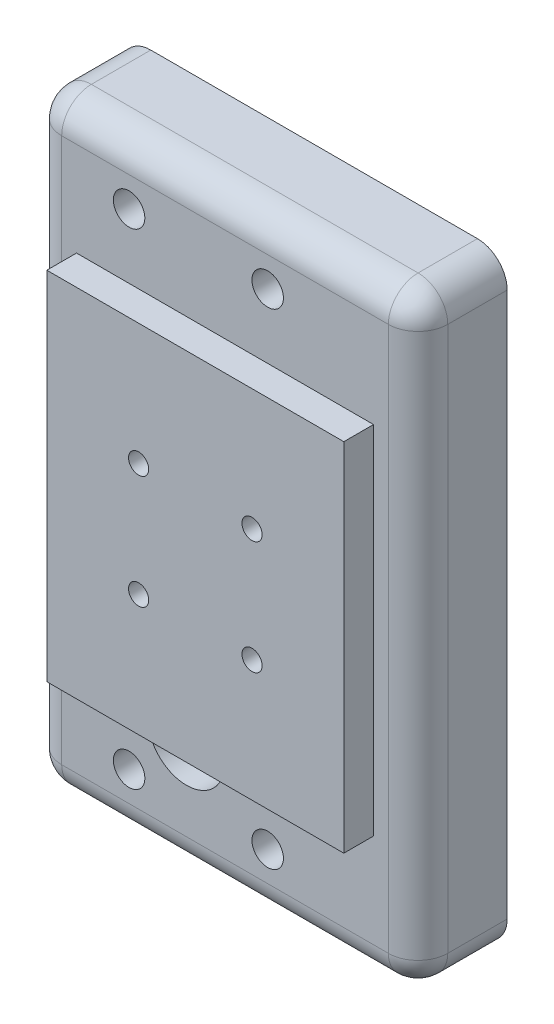
from build123d import *
from build123d.topology import SkipClean

# Parameters (mm, degrees)
STOCK_PART13_1_START       = -68.526253649
STOCK_PART13_1_OUTLINE_W   = 55
STOCK_PART13_1_OUTLINE_H   = 101.7
STOCK_PART13_1_OUTLINE_R   = 1.65
STOCK_PART13_1_OUTLINE_R_2 = 2.25
STOCK_PART13_1_OUTLINE_R_3 = 23.6
STOCK_PART13_1_DEPTH       = 7
SKETCH3_W                  = 5
SKETCH3_H                  = 101.7
BOSS_EXTRUDE1_DEPTH        = 7
FILLET2_R                  = 5
EXTRUDE_THIN1_START        = 8
EXTRUDE_THIN1_DEPTH        = 8
FILLET3_R                  = 5
BOSS_EXTRUDE2_START        = 3
SKETCH7_R                  = 1.65
SKETCH7_R_2                = 2.25
SKETCH7_R_3                = 23.6
BOSS_EXTRUDE2_DEPTH        = 3
SKETCH8_R                  = 23.6
SKETCH8_R_2                = 21
BOSS_EXTRUDE3_DEPTH        = 3
BOSS_EXTRUDE4_START        = -15
SKETCH9_R                  = 4
SKETCH9_R_2                = 1.65
BOSS_EXTRUDE4_DEPTH        = 15
SKETCH10_R                 = 6.5
CUT_EXTRUDE1_DEPTH         = 62.171664192
SKETCH11_W                 = 4
SKETCH11_H                 = 13
CUT_EXTRUDE4_DEPTH         = 62.171664192
FILLET4_R                  = 5
SKETCH12_R                 = 2.65
CUT_EXTRUDE5_DEPTH         = 63.18498613
SKETCH14_W                 = 50
SKETCH14_H                 = 60
SKETCH14_R                 = 1.7
BOSS_EXTRUDE5_DEPTH        = 5
SKETCH16_R                 = 1.95
BOSS_EXTRUDE6_DEPTH        = 10


# Read off the part's stored shape, not the designer's step: Stock-Part13-1
with BuildPart() as part:
    # Stock-Part13-1 outline → Stock-Part13-1 (new body)
    with BuildSketch(Plane.XY.offset(STOCK_PART13_1_START)):
        Rectangle(STOCK_PART13_1_OUTLINE_W, STOCK_PART13_1_OUTLINE_H)
        with Locations((-16.15, -40.85)):
            Circle(STOCK_PART13_1_OUTLINE_R, mode=Mode.SUBTRACT)
        with Locations((-21.15, -25)):
            Circle(STOCK_PART13_1_OUTLINE_R_2, mode=Mode.SUBTRACT)
        with Locations((7.183333333, -40.85)):
            Circle(STOCK_PART13_1_OUTLINE_R, mode=Mode.SUBTRACT)
        with Locations((18.85, -25)):
            Circle(STOCK_PART13_1_OUTLINE_R_2, mode=Mode.SUBTRACT)
        with Locations((-21.15, 25)):
            Circle(STOCK_PART13_1_OUTLINE_R_2, mode=Mode.SUBTRACT)
        with Locations((-16.15, 40.85)):
            Circle(STOCK_PART13_1_OUTLINE_R, mode=Mode.SUBTRACT)
        Circle(STOCK_PART13_1_OUTLINE_R_3, mode=Mode.SUBTRACT)
        with Locations((18.85, 25)):
            Circle(STOCK_PART13_1_OUTLINE_R_2, mode=Mode.SUBTRACT)
        with Locations((7.183333333, 40.85)):
            Circle(STOCK_PART13_1_OUTLINE_R, mode=Mode.SUBTRACT)
    extrude(amount=STOCK_PART13_1_DEPTH)

    # Sketch3 → Boss-Extrude1 (add)
    with BuildSketch(Plane.XY.offset(-61.526253649)):
        with Locations((-30, 0)):
            Rectangle(SKETCH3_W, SKETCH3_H)
        with Locations((30, 0)):
            Rectangle(SKETCH3_W, SKETCH3_H)
    extrude(amount=-BOSS_EXTRUDE1_DEPTH)

    # Fillet2
    fillet2_edges = [part.edges().sort_by_distance(p)[0] for p in [
        (-32.5, -50.85, -65.026253649),
        (-32.5, 50.85, -65.026253649),
        (32.5, 50.85, -65.026253649),
        (32.5, -50.85, -65.026253649),
    ]]
    fillet(fillet2_edges, radius=FILLET2_R)

    # Sketch5 → Extrude-Thin1 (add)
    with BuildSketch(Plane(origin=(0, 0, -68.526253649), x_dir=(-1, 0, 0), z_dir=(0, 0, -1)).offset(EXTRUDE_THIN1_START)):
        with BuildLine():
            Line((-27.5, -50.85), (27.5, -50.85))
            ThreePointArc((27.5, -50.85), (31.035533906, -49.385533906), (32.5, -45.85))
            Line((32.5, -45.85), (32.5, 45.85))
            ThreePointArc((32.5, 45.85), (31.035533906, 49.385533906), (27.5, 50.85))
            Line((27.5, 50.85), (-27.5, 50.85))
            ThreePointArc((-27.5, 50.85), (-31.035533906, 49.385533906), (-32.5, 45.85))
            Line((-32.5, 45.85), (-32.5, -45.85))
            ThreePointArc((-32.5, -45.85), (-31.035533906, -49.385533906), (-27.5, -50.85))
        make_face()
        with BuildLine():
            Line((-27.5, -46.85), (27.5, -46.85))
            ThreePointArc((27.5, -46.85), (28.207106781, -46.557106781), (28.5, -45.85))
            Line((28.5, -45.85), (28.5, 45.85))
            ThreePointArc((28.5, 45.85), (28.207106781, 46.557106781), (27.5, 46.85))
            Line((27.5, 46.85), (-27.5, 46.85))
            ThreePointArc((-27.5, 46.85), (-28.207106781, 46.557106781), (-28.5, 45.85))
            Line((-28.5, 45.85), (-28.5, -45.85))
            ThreePointArc((-28.5, -45.85), (-28.207106781, -46.557106781), (-27.5, -46.85))
        make_face(mode=Mode.SUBTRACT)
    extrude(amount=-EXTRUDE_THIN1_DEPTH)

    # Fillet3
    fillet3_edges = [part.edges().sort_by_distance(p)[0] for p in [
        (-32.5, 0, -61.526253649),
        (0, -50.85, -61.526253649),
        (32.5, 0, -61.526253649),
        (0, 50.85, -61.526253649),
        (-31.035533906, 49.385533906, -61.526253649),
        (31.035533906, 49.385533906, -61.526253649),
        (31.035533906, -49.385533906, -61.526253649),
        (-31.035533906, -49.385533906, -61.526253649),
    ]]
    fillet(fillet3_edges, radius=FILLET3_R)

    # Sketch7 → Boss-Extrude2 (add)
    with SkipClean():  # the faces are left unmerged after this step: merging them gives an invalid solid
        with BuildSketch(Plane(origin=(0, 0, -68.526253649), x_dir=(-1, 0, 0), z_dir=(0, 0, -1)).offset(BOSS_EXTRUDE2_START)):
            with BuildLine():
                Line((-28.5, 45.85), (-28.5, -45.85))
                ThreePointArc((-28.5, -45.85), (-28.207106781, -46.557106781), (-27.5, -46.85))
                Line((-27.5, -46.85), (27.5, -46.85))
                ThreePointArc((27.5, -46.85), (28.207106781, -46.557106781), (28.5, -45.85))
                Line((28.5, -45.85), (28.5, 45.85))
                ThreePointArc((28.5, 45.85), (28.207106781, 46.557106781), (27.5, 46.85))
                Line((27.5, 46.85), (-27.5, 46.85))
                ThreePointArc((-27.5, 46.85), (-28.207106781, 46.557106781), (-28.5, 45.85))
            make_face()
            with Locations((-7.183333333, -40.85)):
                Circle(SKETCH7_R, mode=Mode.SUBTRACT)
            with Locations((16.15, -40.85)):
                Circle(SKETCH7_R, mode=Mode.SUBTRACT)
            with Locations((21.15, -25)):
                Circle(SKETCH7_R_2, mode=Mode.SUBTRACT)
            with Locations((-18.85, -25)):
                Circle(SKETCH7_R_2, mode=Mode.SUBTRACT)
            Circle(SKETCH7_R_3, mode=Mode.SUBTRACT)
            with Locations((21.15, 25)):
                Circle(SKETCH7_R_2, mode=Mode.SUBTRACT)
            with Locations((-7.183333333, 40.85)):
                Circle(SKETCH7_R, mode=Mode.SUBTRACT)
            with Locations((16.15, 40.85)):
                Circle(SKETCH7_R, mode=Mode.SUBTRACT)
            with Locations((-18.85, 25)):
                Circle(SKETCH7_R_2, mode=Mode.SUBTRACT)
        extrude(amount=-BOSS_EXTRUDE2_DEPTH)

    # Sketch8 → Boss-Extrude3 (add)
    with SkipClean():  # the faces are left unmerged after this step: merging them gives an invalid solid
        with BuildSketch(Plane(origin=(0, 0, -71.526253649), x_dir=(-1, 0, 0), z_dir=(0, 0, -1))):
            Circle(SKETCH8_R)
            Circle(SKETCH8_R_2, mode=Mode.SUBTRACT)
        extrude(amount=-BOSS_EXTRUDE3_DEPTH)

    # Sketch9 → Boss-Extrude4 (add)
    # profile 1 of 4: a face of its own
    with SkipClean():  # the faces are left unmerged after this step: merging them gives an invalid solid
        with BuildSketch(Plane.XY.offset(-61.526253649).offset(BOSS_EXTRUDE4_START)):
            with Locations(Location((7.183333333, 40.85, 0), (0, 0, 180))):
                Circle(SKETCH9_R)
            with Locations(Location((7.183333333, 40.85, 0), (0, 0, 180))):
                Circle(SKETCH9_R_2, mode=Mode.SUBTRACT)
        # profile 2 of 4: a face of its own
        with BuildSketch(Plane.XY.offset(-61.526253649).offset(BOSS_EXTRUDE4_START)):
            with Locations(Location((-16.15, 40.85, 0), (0, 0, 180))):
                Circle(SKETCH9_R)
            with Locations(Location((-16.15, 40.85, 0), (0, 0, 180))):
                Circle(SKETCH9_R_2, mode=Mode.SUBTRACT)
        # profile 3 of 4: a face of its own
        with BuildSketch(Plane.XY.offset(-61.526253649).offset(BOSS_EXTRUDE4_START)):
            with Locations(Location((-16.15, -40.85, 0), (0, 0, 180))):
                Circle(SKETCH9_R)
            with Locations(Location((-16.15, -40.85, 0), (0, 0, 180))):
                Circle(SKETCH9_R_2, mode=Mode.SUBTRACT)
        # profile 4 of 4: a face of its own
        with BuildSketch(Plane.XY.offset(-61.526253649).offset(BOSS_EXTRUDE4_START)):
            with Locations(Location((7.183333333, -40.85, 0), (0, 0, 180))):
                Circle(SKETCH9_R)
            with Locations(Location((7.183333333, -40.85, 0), (0, 0, 180))):
                Circle(SKETCH9_R_2, mode=Mode.SUBTRACT)
        extrude(amount=BOSS_EXTRUDE4_DEPTH)

    # Sketch10 → Cut-Extrude1 (cut, through all)
    with SkipClean():  # the faces are left unmerged after this step: merging them gives an invalid solid
        with BuildSketch(Plane(origin=(0, 0, -71.526253649), x_dir=(-1, 0, 0), z_dir=(0, 0, -1))):
            with Locations((6.5, -31.85)):
                Circle(SKETCH10_R)
        extrude(amount=-CUT_EXTRUDE1_DEPTH, mode=Mode.SUBTRACT)

    # Sketch11 → Cut-Extrude4 (cut, through all)
    with SkipClean():  # the faces are left unmerged after this step: merging them gives an invalid solid
        with BuildSketch(Plane(origin=(0, 0, -71.526253649), x_dir=(-1, 0, 0), z_dir=(0, 0, -1))):
            with Locations((30.5, -31.85)):
                Rectangle(SKETCH11_W, SKETCH11_H)
        extrude(amount=CUT_EXTRUDE4_DEPTH, mode=Mode.SUBTRACT)

    # Fillet4
    fillet4_edges = [part.edges().sort_by_distance(p)[0] for p in [
        (-30.5, -38.35, -76.526253649),
        (-30.5, -25.35, -76.526253649),
    ]]
    fillet(fillet4_edges, radius=FILLET4_R - 0.0001)  # a hair under: the kernel refuses the full size

    # Sketch12 → Cut-Extrude5 (cut, through all)
    with BuildSketch(Plane.XY.offset(-61.526253649)):
        with Locations((-16.15, 40.85)):
            Circle(SKETCH12_R)
        with Locations((7.183333333, 40.85)):
            Circle(SKETCH12_R)
        with Locations((7.183333333, -40.85)):
            Circle(SKETCH12_R)
        with Locations((-16.15, -40.85)):
            Circle(SKETCH12_R)
    extrude(amount=-CUT_EXTRUDE5_DEPTH, mode=Mode.SUBTRACT)


with BuildPart() as body_2:
    # Sketch14 → Boss-Extrude5 (new body)
    with BuildSketch(Plane.XY.offset(-61.526253649)):
        Rectangle(SKETCH14_W, SKETCH14_H)
        with Locations((9.545941546, 9.545941546)):
            Circle(SKETCH14_R, mode=Mode.SUBTRACT)
        with Locations((9.545941546, -9.545941546)):
            Circle(SKETCH14_R, mode=Mode.SUBTRACT)
        with Locations((-9.545941546, -9.545941546)):
            Circle(SKETCH14_R, mode=Mode.SUBTRACT)
        with Locations((-9.545941546, 9.545941546)):
            Circle(SKETCH14_R, mode=Mode.SUBTRACT)
    extrude(amount=BOSS_EXTRUDE5_DEPTH)

    # Sketch16 → Boss-Extrude6 (add)
    with BuildSketch(Plane(origin=(0, 0, -61.526253649), x_dir=(-1, 0, 0), z_dir=(0, 0, -1))):
        with Locations(Location((-18.85, 25, 0), (0, 0, 180))):
            Circle(SKETCH16_R)
        with Locations(Location((21.15, 25, 0), (0, 0, 180))):
            Circle(SKETCH16_R)
        with Locations(Location((-18.85, -25, 0), (0, 0, 180))):
            Circle(SKETCH16_R)
        with Locations(Location((21.15, -25, 0), (0, 0, 180))):
            Circle(SKETCH16_R)
    extrude(amount=BOSS_EXTRUDE6_DEPTH)


solid = Compound([part.part, body_2.part])
